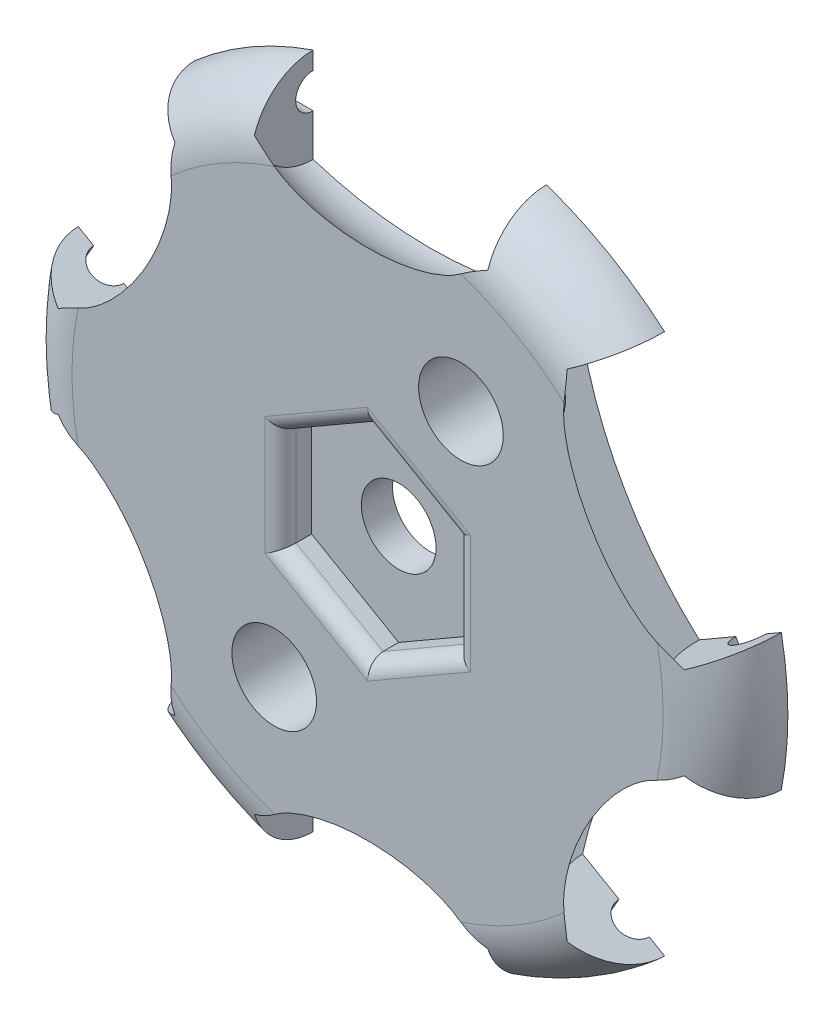
from build123d import *

# Parameters (mm, degrees)
SKETCH1_R           = 18.2626
BOSS_EXTRUDE1_DEPTH = 3.175
FILLET1_R           = 3.18516
SKETCH2_R           = 2.159
SKETCH2_R_2         = 1.905
CUT_EXTRUDE1_DEPTH  = 27.021617144
SKETCH6_R           = 0.889
CUT_EXTRUDE2_DEPTH  = 7.9375
CIRPATTERN1_COUNT   = 6
CUT_EXTRUDE4_DEPTH  = 1.5875
FILLET2_R           = 0.79375


with BuildPart() as part:
    # Sketch1 → Boss-Extrude1 (new body)
    with BuildSketch(Plane.XY):
        Circle(SKETCH1_R)
    extrude(amount=BOSS_EXTRUDE1_DEPTH)

    # Fillet1
    # the kernel refuses this fillet: 3.18516 mm, written as the material it takes off along each edge
    with BuildSketch(Plane(origin=(0, 0, 3.175), x_dir=(1, 0, 0), z_dir=(0, -1, 0))) as fillet1_piece_1:
        with BuildLine():
            CenterArc((18.2626 - FILLET1_R, -FILLET1_R), FILLET1_R, 0, 90)
            Line((18.2626 - FILLET1_R, 0), (18.2626, 0))
            Line((18.2626, 0), (18.2626, -FILLET1_R))
        make_face()
    revolve(axis=Axis((0, 0, 3.175), (0, 0, 1)), mode=Mode.SUBTRACT)

    # Sketch2 → Cut-Extrude1 (cut, through all)
    with BuildSketch(Plane.XY.offset(3.175)):
        with Locations((4.7625, 8.248891971)):
            Circle(SKETCH2_R)
        with Locations((-4.7625, -8.248891971)):
            Circle(SKETCH2_R)
        Circle(SKETCH2_R_2)
    extrude(amount=-CUT_EXTRUDE1_DEPTH, mode=Mode.SUBTRACT)

    # Sketch5 → Cut-Revolve1 (revolve, cut)
    with BuildSketch(Plane.XY):
        with BuildLine():
            Line((-5.953125, 15.4686), (5.953125, 15.4686))
            Line((5.953125, 15.4686), (5.953125, 18.503266678))
            ThreePointArc((5.953125, 18.503266678), (0, 19.43735), (-5.953125, 18.503266678))
            Line((-5.953125, 18.503266678), (-5.953125, 15.4686))
        make_face()
    cut_revolve1 = revolve(axis=Axis((-5.953125, 15.4686, 0), (-1, 0, 0)), mode=Mode.SUBTRACT)

    # Sketch6 → Cut-Extrude2 (cut, symmetric)
    with BuildSketch(Plane(origin=(0, 0, 0), x_dir=(0, 0, -1), z_dir=(1, 0, 0))):
        with Locations((0, 15.4686)):
            Circle(SKETCH6_R)
    cut_extrude2 = extrude(amount=CUT_EXTRUDE2_DEPTH, both=True, mode=Mode.SUBTRACT)

    # CirPattern1: Cut-Revolve1, Cut-Extrude2 ×6 about axis
    cirpattern1_axis = Axis((0, 0, 0), (0, 0, 1))
    add([cut_revolve1.rotate(cirpattern1_axis, i * 360 / CIRPATTERN1_COUNT) for i in range(1, CIRPATTERN1_COUNT)], mode=Mode.SUBTRACT)
    add([cut_extrude2.rotate(cirpattern1_axis, i * 360 / CIRPATTERN1_COUNT) for i in range(1, CIRPATTERN1_COUNT)], mode=Mode.SUBTRACT)

    # Sketch8 → Cut-Extrude4 (cut)
    with BuildSketch(Plane.XY.offset(3.175)):
        Polygon((0, 5.132643893), (-4.445, 2.566321947), (-4.445, -2.566321947), (0, -5.132643893), (4.445, -2.566321947), (4.445, 2.566321947), align=None)
    extrude(amount=-CUT_EXTRUDE4_DEPTH, mode=Mode.SUBTRACT)

    # Fillet2
    fillet2_edges = [part.edges().sort_by_distance(p)[0] for p in [
        (2.2225, 3.84948292, 3.175),
        (-2.2225, 3.84948292, 3.175),
        (-4.445, 0, 3.175),
        (-2.2225, -3.84948292, 3.175),
        (2.2225, -3.84948292, 3.175),
        (4.445, 0, 3.175),
    ]]
    fillet(fillet2_edges, radius=FILLET2_R)


solid = part.part
